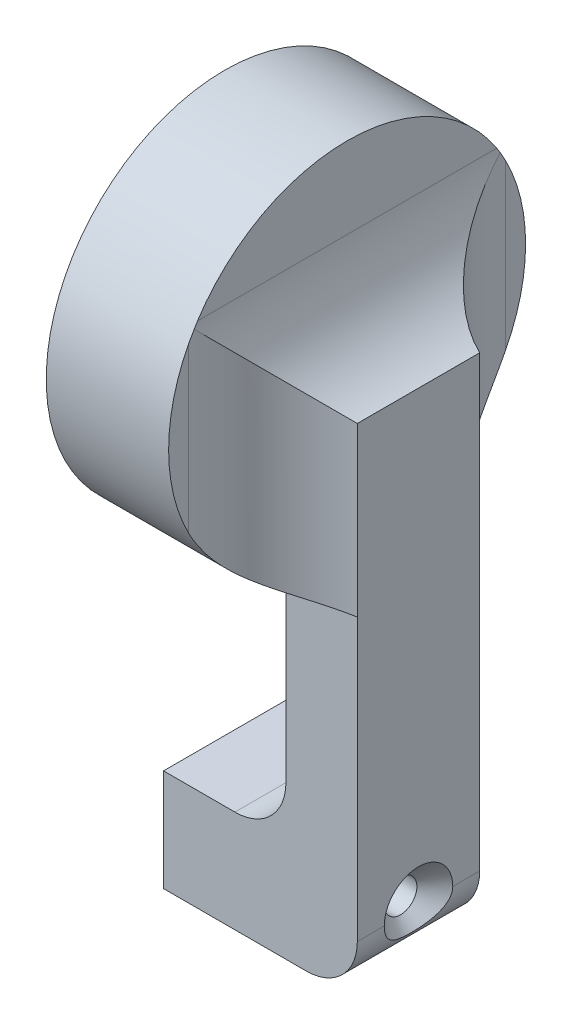
from build123d import *

# Parameters (mm, degrees)
BOSS_EXTRUDE1_DEPTH           = 12
FILLET2_R                     = 5
CSK_FOR_M3_SFHCS1_D           = 3.2
CSK_FOR_M3_SFHCS1_DEPTH       = 20
CSK_FOR_M3_SFHCS1_CSINK_D     = 6.72
CSK_FOR_M3_SFHCS1_CSINK_ANGLE = 90
CSK_FOR_M3_SFHCS1_TIP         = 0.96137699
SKETCH2_R                     = 9
BOSS_EXTRUDE2_DEPTH           = 18
SKETCH5_R                     = 17.5
BOSS_EXTRUDE3_DEPTH           = 12
FILLET3_R                     = 10


with BuildPart() as part:
    # Sketch1 → Boss-Extrude1 (new body)
    with BuildSketch(Plane.XY):
        Polygon((-7, 10), (-19, 10), (-19, 0), (0, 0), (0, 49), (-7, 49), align=None)
    extrude(amount=BOSS_EXTRUDE1_DEPTH)

    # Fillet2
    fillet2_edges = [part.edges().sort_by_distance(p)[0] for p in [
        (-7, 10, 6),
        (0, 0, 6),
    ]]
    fillet(fillet2_edges, radius=FILLET2_R)

    # CSK for M3 SFHCS1
    with Locations(Plane(origin=(0, 0, 0), x_dir=(0, 0, -1), z_dir=(1, 0, 0))):
        with Locations((-6, 5)):
            CounterSinkHole(CSK_FOR_M3_SFHCS1_D / 2, CSK_FOR_M3_SFHCS1_CSINK_D / 2, depth=CSK_FOR_M3_SFHCS1_DEPTH, counter_sink_angle=CSK_FOR_M3_SFHCS1_CSINK_ANGLE)
            with Locations((0, 0, -(CSK_FOR_M3_SFHCS1_DEPTH + CSK_FOR_M3_SFHCS1_TIP / 2))):  # 118° drill point
                Cone(0, CSK_FOR_M3_SFHCS1_D / 2, CSK_FOR_M3_SFHCS1_TIP, mode=Mode.SUBTRACT)

    # Sketch2 → Boss-Extrude2 (add)
    with BuildSketch(Plane.ZY.offset(7)):
        with Locations(Location((6, 49, 0), (0, 0, 228.189685104))):
            Circle(SKETCH2_R)
    extrude(amount=BOSS_EXTRUDE2_DEPTH)

    # Sketch5 → Boss-Extrude3 (add)
    with BuildSketch(Plane(origin=(-7, 0, 0), x_dir=(0, 0, -1), z_dir=(1, 0, 0))):
        with Locations(Location((-6, 49, 0), (0, 0, 90))):
            Circle(SKETCH5_R)
    extrude(amount=-BOSS_EXTRUDE3_DEPTH)

    # Fillet3
    # the kernel refuses this fillet: 10 mm, written as the material it adds along each edge
    with BuildSketch(Plane(origin=(-7, 8.712237742, 0), x_dir=(0, 0, -1), z_dir=(0, 1, 0))) as fillet3_piece_1_section:
        with BuildLine():
            CenterArc((9.539392014, -10), FILLET3_R, 90, 72.542396876)
            Line((0, -7), (0, 0))
            Line((0, 0), (9.539392014, 0))
        make_face()
    fillet3_piece_1 = extrude(amount=40.287762258, mode=Mode.PRIVATE)
    fillet3_piece_1 = fillet3_piece_1 & Plane(origin=(-7, 49, 6), x_dir=(0, 1, 0), z_dir=(1, 0, 0)) * Cylinder(17.5, 119, mode=Mode.PRIVATE)
    add(fillet3_piece_1)
    with BuildSketch(Plane(origin=(-7, 49, 0), x_dir=(0, 1, 0), z_dir=(0, 0, 1))) as fillet3_piece_2:
        with BuildLine():
            CenterArc((9.539392014, -10), FILLET3_R, 90, 72.542396876)
            Line((0, -7), (0, 0))
            Line((0, 0), (9.539392014, 0))
        make_face()
    extrude(amount=12)
    with BuildSketch(Plane(origin=(-7, 49, 12), x_dir=(1, 0, 0), z_dir=(0, -1, 0))) as fillet3_piece_3_section:
        with BuildLine():
            CenterArc((10, 9.539392014), FILLET3_R, 180, 72.542396876)
            Line((0, 9.539392014), (0, 0))
            Line((0, 0), (7, 0))
        make_face()
    fillet3_piece_3 = extrude(amount=40.287762258, mode=Mode.PRIVATE)
    fillet3_piece_3 = fillet3_piece_3 & Plane(origin=(-7, 49, 6), x_dir=(0, 1, 0), z_dir=(1, 0, 0)) * Cylinder(17.5, 119, mode=Mode.PRIVATE)
    add(fillet3_piece_3)
    with BuildSketch(Plane(origin=(-7, 8.712237742, 0), x_dir=(0, 0, -1), z_dir=(0, 1, 0))) as fillet3_piece_4a_section:
        with BuildLine():
            CenterArc((9.539392014, -10), FILLET3_R, 90, 72.542396876)
            Line((0, -7), (0, 0))
            Line((0, 0), (9.539392014, 0))
        make_face()
    fillet3_piece_4a = extrude(amount=64.136242294, mode=Mode.PRIVATE)
    fillet3_piece_4a = fillet3_piece_4a & Plane(origin=(-7, 49, 6), x_dir=(0, 1, 0), z_dir=(1, 0, 0)) * Cylinder(17.5, 167, mode=Mode.PRIVATE)
    fillet3_piece_4a = split(fillet3_piece_4a, bisect_by=Plane(origin=(-7, 49, 0), z_dir=(0, 1, 0)), keep=Keep.TOP, mode=Mode.PRIVATE)
    with BuildSketch(Plane(origin=(-7, 49, -23.848480035), x_dir=(0, 1, 0), z_dir=(0, 0, 1))) as fillet3_piece_4b_section:
        with BuildLine():
            CenterArc((9.539392014, -10), FILLET3_R, 90, 72.542396876)
            Line((0, -7), (0, 0))
            Line((0, 0), (9.539392014, 0))
        make_face()
    fillet3_piece_4b = extrude(amount=35.848480035, mode=Mode.PRIVATE)
    fillet3_piece_4b = fillet3_piece_4b & Plane(origin=(-7, 49, 6), x_dir=(0, 1, 0), z_dir=(1, 0, 0)) * Cylinder(17.5, 110, mode=Mode.PRIVATE)
    fillet3_piece_4b = split(fillet3_piece_4b, bisect_by=Plane(origin=(-7, 49, 0), z_dir=(0, 0, -1)), keep=Keep.TOP, mode=Mode.PRIVATE)
    fillet3_piece_4 = fillet3_piece_4a & fillet3_piece_4b
    add(fillet3_piece_4)
    with BuildSketch(Plane(origin=(-7, 72.848480035, 12), x_dir=(1, 0, 0), z_dir=(0, -1, 0))) as fillet3_piece_5a_section:
        with BuildLine():
            CenterArc((10, 9.539392014), FILLET3_R, 180, 72.542396876)
            Line((0, 9.539392014), (0, 0))
            Line((0, 0), (7, 0))
        make_face()
    fillet3_piece_5a = extrude(amount=64.136242294, mode=Mode.PRIVATE)
    fillet3_piece_5a = fillet3_piece_5a & Plane(origin=(-7, 49, 6), x_dir=(0, 1, 0), z_dir=(1, 0, 0)) * Cylinder(17.5, 167, mode=Mode.PRIVATE)
    fillet3_piece_5a = split(fillet3_piece_5a, bisect_by=Plane(origin=(-7, 49, 12), z_dir=(0, 1, 0)), keep=Keep.TOP, mode=Mode.PRIVATE)
    with BuildSketch(Plane(origin=(-7, 49, 0), x_dir=(0, 1, 0), z_dir=(0, 0, 1))) as fillet3_piece_5b_section:
        with BuildLine():
            CenterArc((9.539392014, -10), FILLET3_R, 90, 72.542396876)
            Line((0, -7), (0, 0))
            Line((0, 0), (9.539392014, 0))
        make_face()
    fillet3_piece_5b = extrude(amount=35.848480035, mode=Mode.PRIVATE)
    fillet3_piece_5b = split(fillet3_piece_5b, bisect_by=Plane(origin=(-7, 49, 12), z_dir=(0, 0, 1)), keep=Keep.TOP, mode=Mode.PRIVATE)
    fillet3_piece_5b = fillet3_piece_5b & Plane(origin=(-7, 49, 6), x_dir=(0, 1, 0), z_dir=(1, 0, 0)) * Cylinder(17.5, 110, mode=Mode.PRIVATE)
    fillet3_piece_5 = fillet3_piece_5a & fillet3_piece_5b
    add(fillet3_piece_5)


solid = part.part
